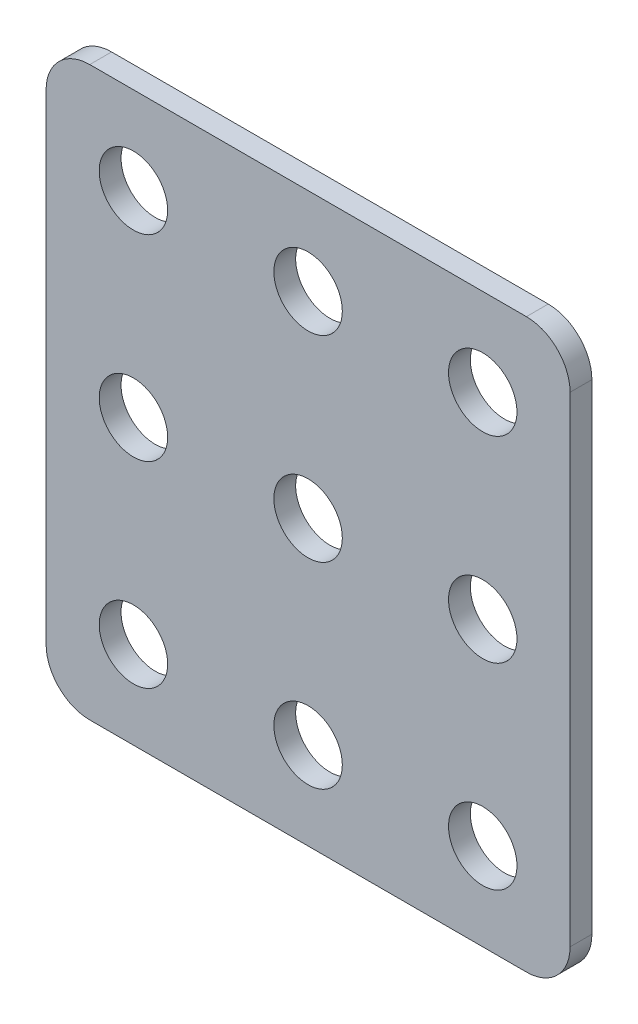
from build123d import *

# Parameters (mm, degrees)
SKETCH1_W           = 38.1
SKETCH1_H           = 41.275
SKETCH1_R           = 2.4892
BOSS_EXTRUDE1_DEPTH = 0.79375
LPATTERN1_START     = -0.79375
LPATTERN1_OUTLINE_R = 2.4892
LPATTERN1_DEPTH     = 1.5875
FILLET1_R           = 3.175


# Read off the part's stored shape, not the designer's step: LPattern1
with BuildPart() as part:
    # Sketch1 → Boss-Extrude1 (new, symmetric)
    with BuildSketch(Plane.XY):
        with Locations((19.05, 20.6375)):
            Rectangle(SKETCH1_W, SKETCH1_H)
        with Locations((6.35, 6.35)):
            Circle(SKETCH1_R, mode=Mode.SUBTRACT)
    extrude(amount=BOSS_EXTRUDE1_DEPTH, both=True)

    # LPattern1 outline → LPattern1 (cut)
    with BuildSketch(Plane.XY.offset(LPATTERN1_START)):
        with Locations((31.75, 34.925)):
            Circle(LPATTERN1_OUTLINE_R)
        with Locations((31.75, 20.6375)):
            Circle(LPATTERN1_OUTLINE_R)
        with Locations((31.75, 6.35)):
            Circle(LPATTERN1_OUTLINE_R)
        with Locations((19.05, 34.925)):
            Circle(LPATTERN1_OUTLINE_R)
        with Locations((19.05, 20.6375)):
            Circle(LPATTERN1_OUTLINE_R)
        with Locations((19.05, 6.35)):
            Circle(LPATTERN1_OUTLINE_R)
        with Locations((6.35, 34.925)):
            Circle(LPATTERN1_OUTLINE_R)
        with Locations((6.35, 20.6375)):
            Circle(LPATTERN1_OUTLINE_R)
    extrude(amount=LPATTERN1_DEPTH, mode=Mode.SUBTRACT)

    # Fillet1
    fillet1_edges = [part.edges().sort_by_distance(p)[0] for p in [
        (0, 41.275, 0),
        (38.1, 41.275, 0),
        (38.1, 0, 0),
        (0, 0, 0),
    ]]
    fillet(fillet1_edges, radius=FILLET1_R)


solid = part.part
